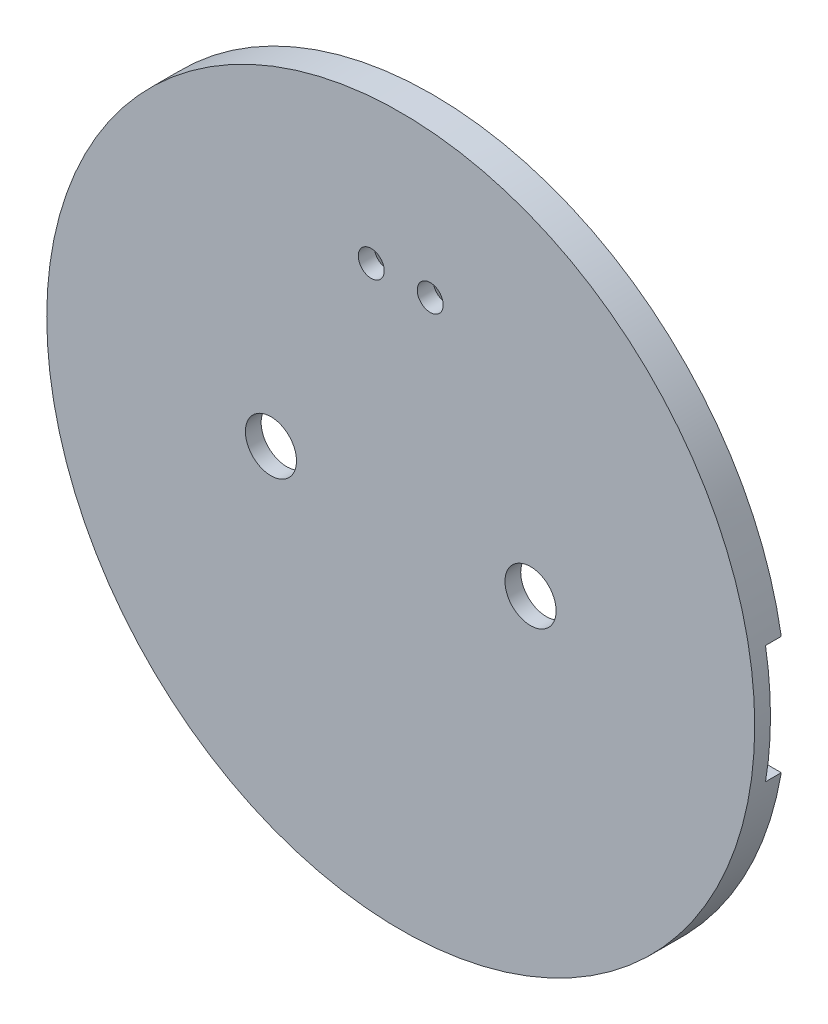
from build123d import *

# Parameters (mm, degrees)
ESBO_O1_R                                           = 90
FLANGE_BASE2_DEPTH                                  = 8
CORTE_EXTRUS_O3_START                               = -4
CORTE_EXTRUS_O3_DEPTH                               = 4
ESBO_O13_R                                          = 6.5
CORTE_EXTRUS_O4_DEPTH                               = 4
ESCAREADO_PARA_PARAFUSO_ALLEN_SEXTAVADO_D           = 6.6
ESCAREADO_PARA_PARAFUSO_ALLEN_SEXTAVADO_CSINK_D     = 14.44
ESCAREADO_PARA_PARAFUSO_ALLEN_SEXTAVADO_CSINK_ANGLE = 90


# Sheet-metal steps are written as plain solids
with BuildPart() as part:
    # Esboço1 → Flange-base2 (new body)
    with BuildSketch(Plane.XY):
        Circle(ESBO_O1_R)
    extrude(amount=-FLANGE_BASE2_DEPTH)

    # Esboço12 → Corte-extrusão3 (cut)
    with BuildSketch(Plane(origin=(0, 0, -8), x_dir=(-1, 0, 0), z_dir=(0, 0, -1)).offset(CORTE_EXTRUS_O3_START)):
        with BuildLine():
            Line((-88.741196746, 15), (88.741196746, 15))
            ThreePointArc((88.741196746, 15), (90, 0), (88.741196746, -15))
            Line((88.741196746, -15), (-88.741196746, -15))
            ThreePointArc((-88.741196746, -15), (-90, 0), (-88.741196746, 15))
        make_face()
    extrude(amount=CORTE_EXTRUS_O3_DEPTH, mode=Mode.SUBTRACT)

    # Esboço13 → Corte-extrusão4 (cut)
    with BuildSketch(Plane(origin=(0, 0, -4), x_dir=(-1, 0, 0), z_dir=(0, 0, -1))):
        with Locations((33, 0)):
            Circle(ESBO_O13_R)
        with Locations((-33, 0)):
            Circle(ESBO_O13_R)
    extrude(amount=-CORTE_EXTRUS_O4_DEPTH, mode=Mode.SUBTRACT)

    # Escareado para parafuso Allen sextavado escareado de M63 (through all)
    with Locations(Plane(origin=(0, 0, -8), x_dir=(-1, 0, 0), z_dir=(0, 0, -1))):
        with Locations((-7.5, 53), (7.5, 53)):
            CounterSinkHole(ESCAREADO_PARA_PARAFUSO_ALLEN_SEXTAVADO_D / 2, ESCAREADO_PARA_PARAFUSO_ALLEN_SEXTAVADO_CSINK_D / 2, counter_sink_angle=ESCAREADO_PARA_PARAFUSO_ALLEN_SEXTAVADO_CSINK_ANGLE)


solid = part.part
